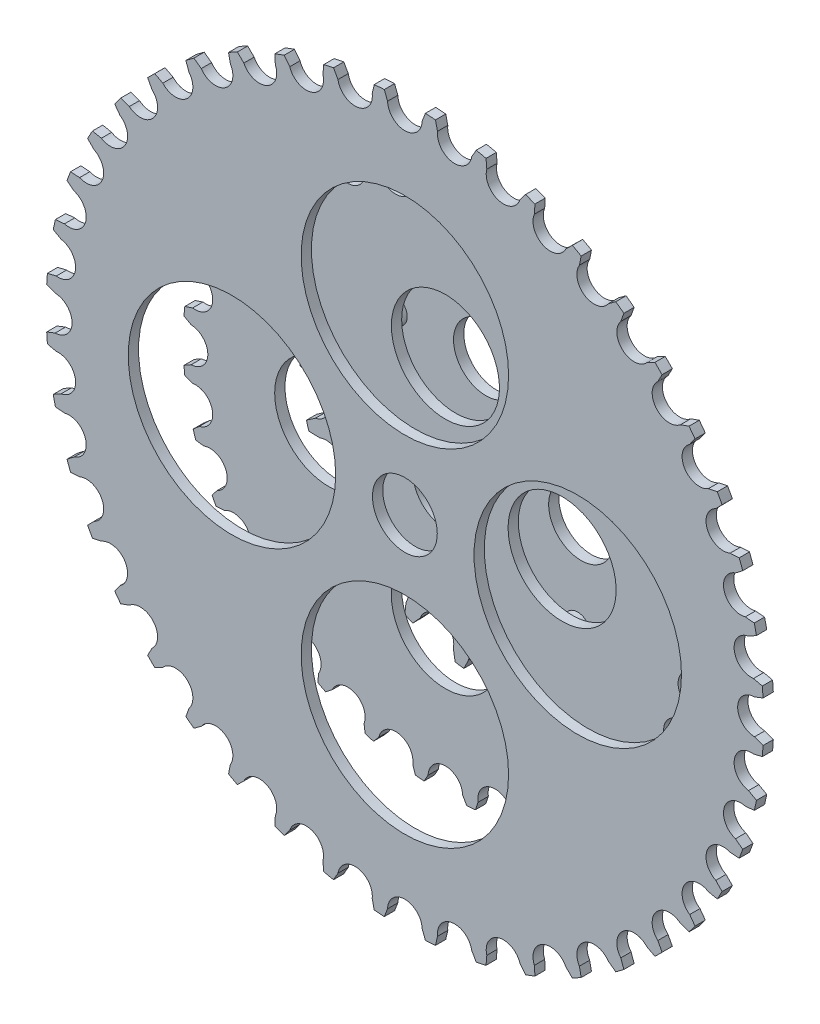
from build123d import *

# Parameters (mm, degrees)
IZIM1_R                     = 83
Y_KSEKLIK_EKSTR_ZYON1_DEPTH = 2.38
KES_EKSTR_ZYON1_REACH       = 119.404
DAIRESEL_O_ALTMA1_COUNT     = 44
KES_EKSTR_ZYON2_REACH       = 119.211
IZIM3_R                     = 24
IZIM3_R_2                   = 7.5
DAIRESEL_O_ALTMA2_COUNT     = 4
IZIM4_R                     = 2.5
Y_KSEKLIK_EKSTR_ZYON2_DEPTH = 7
DAIRESEL_O_ALTMA3_COUNT     = 4
IZIM5_R                     = 60.685
Y_KSEKLIK_EKSTR_ZYON3_DEPTH = 2.38
KES_EKSTR_ZYON3_REACH       = 119.775
DAIRESEL_O_ALTMA4_COUNT     = 32
KES_EKSTR_ZYON4_REACH       = 119.775
IZIM7_R                     = 12.5
IZIM8_R                     = 3
Y_KSEKLIK_EKSTR_ZYON4_DEPTH = 7
IZIM9_R                     = 43
Y_KSEKLIK_EKSTR_ZYON5_DEPTH = 2.38
KES_EKSTR_ZYON5_REACH       = 121.078
DAIRESEL_O_ALTMA5_COUNT     = 22
KES_EKSTR_ZYON6_REACH       = 121.078
IZIM13_R                    = 7.5
IZIM14_R                    = 7.5
KES_EKSTR_ZYON7_DEPTH       = 120.078107026


with BuildPart() as part:
    # Çizim1 → Yükseklik-Ekstrüzyon1 (new body)
    with BuildSketch(Plane.XY):
        Circle(IZIM1_R)
    extrude(amount=Y_KSEKLIK_EKSTR_ZYON1_DEPTH)

    # Çizim2 → Kes-Ekstrüzyon1 (cut, up to next)
    with BuildSketch(Plane.XY.offset(2.38), mode=Mode.PRIVATE) as kes_ekstr_zyon1_sk1:
        with BuildLine():
            Line((5.139003334, 83.842654089), (3.998780488, 80.901234568))
            ThreePointArc((3.998780488, 80.901234568), (0, 77), (-3.998780488, 80.901234568))
            Line((-3.998780488, 80.901234568), (-5.139003334, 83.842654089))
            ThreePointArc((-5.139003334, 83.842654089), (0, 84), (5.139003334, 83.842654089))
        make_face()
    kes_ekstr_zyon1_tool1 = extrude(kes_ekstr_zyon1_sk1.sketch, amount=-KES_EKSTR_ZYON1_REACH, mode=Mode.PRIVATE) & part.part
    kes_ekstr_zyon1 = kes_ekstr_zyon1_tool1.solids().sort_by_distance((0, 80.981356, 2.38))[0]
    add(kes_ekstr_zyon1, mode=Mode.SUBTRACT)

    # Dairesel Çoğaltma1: Kes-Ekstrüzyon1 ×44 about axis
    dairesel_o_altma1_axis = Axis((0, 0, 2.38), (0, 0, 1))
    for i in range(1, DAIRESEL_O_ALTMA1_COUNT):
        add(kes_ekstr_zyon1.rotate(dairesel_o_altma1_axis, i * 360 / DAIRESEL_O_ALTMA1_COUNT), mode=Mode.SUBTRACT)

    # Çizim3 → Kes-Ekstrüzyon2 (cut, up to next)
    with BuildSketch(Plane.XY.offset(2.38), mode=Mode.PRIVATE) as kes_ekstr_zyon2_sk1:
        with Locations((0, 40)):
            Circle(IZIM3_R)
    kes_ekstr_zyon2_tool1 = extrude(kes_ekstr_zyon2_sk1.sketch, amount=-KES_EKSTR_ZYON2_REACH, mode=Mode.PRIVATE) & part.part
    # Çizim3 → Kes-Ekstrüzyon2 (cut, up to next)
    with BuildSketch(Plane.XY.offset(2.38), mode=Mode.PRIVATE) as kes_ekstr_zyon2_sk2:
        Circle(IZIM3_R_2)
    kes_ekstr_zyon2_tool2 = extrude(kes_ekstr_zyon2_sk2.sketch, amount=-KES_EKSTR_ZYON2_REACH, mode=Mode.PRIVATE) & part.part
    kes_ekstr_zyon2_1 = kes_ekstr_zyon2_tool1.solids().sort_by_distance((0, 40, 2.38))[0]
    add(kes_ekstr_zyon2_1, mode=Mode.SUBTRACT)
    kes_ekstr_zyon2_2 = kes_ekstr_zyon2_tool2.solids().sort_by_distance((0, 0, 2.38))[0]
    add(kes_ekstr_zyon2_2, mode=Mode.SUBTRACT)
    kes_ekstr_zyon2 = kes_ekstr_zyon2_1 + kes_ekstr_zyon2_2  # Kes-Ekstrüzyon2 as one shape, for the pattern or mirror that repeats it

    # Dairesel Çoğaltma2: Kes-Ekstrüzyon2 ×4 about axis
    dairesel_o_altma2_axis = Axis((0, 0, 2.38), (0, 0, 1))
    for i in range(1, DAIRESEL_O_ALTMA2_COUNT):
        add(kes_ekstr_zyon2.rotate(dairesel_o_altma2_axis, i * 360 / DAIRESEL_O_ALTMA2_COUNT), mode=Mode.SUBTRACT)

    # Çizim4 → Yükseklik-Ekstrüzyon2 (add)
    with BuildSketch(Plane(origin=(0, 0, 0), x_dir=(-1, 0, 0), z_dir=(0, 0, -1))):
        with Locations((35.355339059, 35.355339059)):
            Circle(IZIM4_R)
    y_kseklik_ekstr_zyon2 = extrude(amount=Y_KSEKLIK_EKSTR_ZYON2_DEPTH)

    # Dairesel Çoğaltma3: Yükseklik-Ekstrüzyon2 ×4 about axis
    dairesel_o_altma3_axis = Axis((0, 0, 0), (0, 0, -1))
    for i in range(1, DAIRESEL_O_ALTMA3_COUNT):
        add(y_kseklik_ekstr_zyon2.rotate(dairesel_o_altma3_axis, i * 360 / DAIRESEL_O_ALTMA3_COUNT))

    # Çizim5 → Yükseklik-Ekstrüzyon3 (add)
    with BuildSketch(Plane(origin=(0, 0, -7), x_dir=(-1, 0, 0), z_dir=(0, 0, -1))):
        Circle(IZIM5_R)
    extrude(amount=Y_KSEKLIK_EKSTR_ZYON3_DEPTH)

    # Çizim6 → Kes-Ekstrüzyon3 (cut, up to next)
    with BuildSketch(Plane(origin=(0, 0, -9.38), x_dir=(-1, 0, 0), z_dir=(0, 0, -1)), mode=Mode.PRIVATE) as kes_ekstr_zyon3_sk1:
        with BuildLine():
            Line((3.997509486, 58.828147219), (4.948170161, 60.48293013))
            ThreePointArc((4.948170161, 60.48293013), (0, 60.685), (-4.948170161, 60.48293013))
            Line((-4.948170161, 60.48293013), (-3.997509486, 58.828147219))
            ThreePointArc((-3.997509486, 58.828147219), (0, 54.96927803), (3.997509486, 58.828147219))
        make_face()
    kes_ekstr_zyon3_tool1 = extrude(kes_ekstr_zyon3_sk1.sketch, amount=-KES_EKSTR_ZYON3_REACH, mode=Mode.PRIVATE) & part.part
    kes_ekstr_zyon3 = kes_ekstr_zyon3_tool1.solids().sort_by_distance((0, 58.225198, -9.38))[0]
    add(kes_ekstr_zyon3, mode=Mode.SUBTRACT)

    # Dairesel Çoğaltma4: Kes-Ekstrüzyon3 ×32 about axis
    dairesel_o_altma4_axis = Axis((0, 0, -9.38), (0, 0, -1))
    for i in range(1, DAIRESEL_O_ALTMA4_COUNT):
        add(kes_ekstr_zyon3.rotate(dairesel_o_altma4_axis, i * 360 / DAIRESEL_O_ALTMA4_COUNT), mode=Mode.SUBTRACT)

    # Çizim7 → Kes-Ekstrüzyon4 (cut, up to next)
    with BuildSketch(Plane(origin=(0, 0, -9.38), x_dir=(-1, 0, 0), z_dir=(0, 0, -1)), mode=Mode.PRIVATE) as kes_ekstr_zyon4_sk1:
        with Locations((0, 27)):
            Circle(IZIM7_R)
    kes_ekstr_zyon4_tool1 = extrude(kes_ekstr_zyon4_sk1.sketch, amount=-KES_EKSTR_ZYON4_REACH, mode=Mode.PRIVATE) & part.part
    # Çizim7 → Kes-Ekstrüzyon4 (cut, up to next)
    with BuildSketch(Plane(origin=(0, 0, -9.38), x_dir=(-1, 0, 0), z_dir=(0, 0, -1)), mode=Mode.PRIVATE) as kes_ekstr_zyon4_sk2:
        with Locations((27, 0)):
            Circle(IZIM7_R)
    kes_ekstr_zyon4_tool2 = extrude(kes_ekstr_zyon4_sk2.sketch, amount=-KES_EKSTR_ZYON4_REACH, mode=Mode.PRIVATE) & part.part
    # Çizim7 → Kes-Ekstrüzyon4 (cut, up to next)
    with BuildSketch(Plane(origin=(0, 0, -9.38), x_dir=(-1, 0, 0), z_dir=(0, 0, -1)), mode=Mode.PRIVATE) as kes_ekstr_zyon4_sk3:
        with Locations((0, -27)):
            Circle(IZIM7_R)
    kes_ekstr_zyon4_tool3 = extrude(kes_ekstr_zyon4_sk3.sketch, amount=-KES_EKSTR_ZYON4_REACH, mode=Mode.PRIVATE) & part.part
    # Çizim7 → Kes-Ekstrüzyon4 (cut, up to next)
    with BuildSketch(Plane(origin=(0, 0, -9.38), x_dir=(-1, 0, 0), z_dir=(0, 0, -1)), mode=Mode.PRIVATE) as kes_ekstr_zyon4_sk4:
        with Locations((-27, 0)):
            Circle(IZIM7_R)
    kes_ekstr_zyon4_tool4 = extrude(kes_ekstr_zyon4_sk4.sketch, amount=-KES_EKSTR_ZYON4_REACH, mode=Mode.PRIVATE) & part.part
    add(kes_ekstr_zyon4_tool1.solids().sort_by_distance((0, 27, -9.38))[0], mode=Mode.SUBTRACT)
    add(kes_ekstr_zyon4_tool2.solids().sort_by_distance((-27, 0, -9.38))[0], mode=Mode.SUBTRACT)
    add(kes_ekstr_zyon4_tool3.solids().sort_by_distance((0, -27, -9.38))[0], mode=Mode.SUBTRACT)
    add(kes_ekstr_zyon4_tool4.solids().sort_by_distance((27, 0, -9.38))[0], mode=Mode.SUBTRACT)

    # Çizim8 → Yükseklik-Ekstrüzyon4 (add)
    with BuildSketch(Plane(origin=(0, 0, -9.38), x_dir=(-1, 0, 0), z_dir=(0, 0, -1))):
        with Locations((21.213203436, 21.213203436)):
            Circle(IZIM8_R)
        with Locations((21.213203436, -21.213203436)):
            Circle(IZIM8_R)
        with Locations((-21.213203436, -21.213203436)):
            Circle(IZIM8_R)
        with Locations((-21.213203436, 21.213203436)):
            Circle(IZIM8_R)
    extrude(amount=Y_KSEKLIK_EKSTR_ZYON4_DEPTH)

    # Çizim9 → Yükseklik-Ekstrüzyon5 (add)
    with BuildSketch(Plane(origin=(0, 0, -16.38), x_dir=(-1, 0, 0), z_dir=(0, 0, -1))):
        Circle(IZIM9_R)
    extrude(amount=Y_KSEKLIK_EKSTR_ZYON5_DEPTH)

    # Çizim12 → Kes-Ekstrüzyon5 (cut, up to next)
    with BuildSketch(Plane(origin=(0, 0, -18.76), x_dir=(-1, 0, 0), z_dir=(0, 0, -1)), mode=Mode.PRIVATE) as kes_ekstr_zyon5_sk1:
        with BuildLine():
            Line((3.995147135, 40.417201225), (5.119538046, 42.694148665))
            ThreePointArc((5.119538046, 42.694148665), (0, 43), (-5.119538046, 42.694148665))
            Line((-5.119538046, 42.694148665), (-3.995147135, 40.417201225))
            ThreePointArc((-3.995147135, 40.417201225), (0, 36.61417678), (3.995147135, 40.417201225))
        make_face()
    kes_ekstr_zyon5_tool1 = extrude(kes_ekstr_zyon5_sk1.sketch, amount=-KES_EKSTR_ZYON5_REACH, mode=Mode.PRIVATE) & part.part
    kes_ekstr_zyon5 = kes_ekstr_zyon5_tool1.solids().sort_by_distance((0, 40.239198, -18.76))[0]
    add(kes_ekstr_zyon5, mode=Mode.SUBTRACT)

    # Dairesel Çoğaltma5: Kes-Ekstrüzyon5 ×22 about axis
    dairesel_o_altma5_axis = Axis((0, 0, -18.76), (0, 0, -1))
    for i in range(1, DAIRESEL_O_ALTMA5_COUNT):
        add(kes_ekstr_zyon5.rotate(dairesel_o_altma5_axis, i * 360 / DAIRESEL_O_ALTMA5_COUNT), mode=Mode.SUBTRACT)

    # Çizim13 → Kes-Ekstrüzyon6 (cut, up to next)
    with BuildSketch(Plane(origin=(0, 0, -18.76), x_dir=(-1, 0, 0), z_dir=(0, 0, -1)), mode=Mode.PRIVATE) as kes_ekstr_zyon6_sk1:
        with Locations((0, 22)):
            Circle(IZIM13_R)
    kes_ekstr_zyon6_tool1 = extrude(kes_ekstr_zyon6_sk1.sketch, amount=-KES_EKSTR_ZYON6_REACH, mode=Mode.PRIVATE) & part.part
    # Çizim13 → Kes-Ekstrüzyon6 (cut, up to next)
    with BuildSketch(Plane(origin=(0, 0, -18.76), x_dir=(-1, 0, 0), z_dir=(0, 0, -1)), mode=Mode.PRIVATE) as kes_ekstr_zyon6_sk2:
        with Locations((22, 0)):
            Circle(IZIM13_R)
    kes_ekstr_zyon6_tool2 = extrude(kes_ekstr_zyon6_sk2.sketch, amount=-KES_EKSTR_ZYON6_REACH, mode=Mode.PRIVATE) & part.part
    # Çizim13 → Kes-Ekstrüzyon6 (cut, up to next)
    with BuildSketch(Plane(origin=(0, 0, -18.76), x_dir=(-1, 0, 0), z_dir=(0, 0, -1)), mode=Mode.PRIVATE) as kes_ekstr_zyon6_sk3:
        with Locations((0, -22)):
            Circle(IZIM13_R)
    kes_ekstr_zyon6_tool3 = extrude(kes_ekstr_zyon6_sk3.sketch, amount=-KES_EKSTR_ZYON6_REACH, mode=Mode.PRIVATE) & part.part
    # Çizim13 → Kes-Ekstrüzyon6 (cut, up to next)
    with BuildSketch(Plane(origin=(0, 0, -18.76), x_dir=(-1, 0, 0), z_dir=(0, 0, -1)), mode=Mode.PRIVATE) as kes_ekstr_zyon6_sk4:
        with Locations((-22, 0)):
            Circle(IZIM13_R)
    kes_ekstr_zyon6_tool4 = extrude(kes_ekstr_zyon6_sk4.sketch, amount=-KES_EKSTR_ZYON6_REACH, mode=Mode.PRIVATE) & part.part
    add(kes_ekstr_zyon6_tool1.solids().sort_by_distance((0, 22, -18.76))[0], mode=Mode.SUBTRACT)
    add(kes_ekstr_zyon6_tool2.solids().sort_by_distance((-22, 0, -18.76))[0], mode=Mode.SUBTRACT)
    add(kes_ekstr_zyon6_tool3.solids().sort_by_distance((0, -22, -18.76))[0], mode=Mode.SUBTRACT)
    add(kes_ekstr_zyon6_tool4.solids().sort_by_distance((22, 0, -18.76))[0], mode=Mode.SUBTRACT)

    # Çizim14 → Kes-Ekstrüzyon7 (cut, through all)
    with BuildSketch(Plane.XY.offset(2.38)):
        Circle(IZIM14_R)
    extrude(amount=-KES_EKSTR_ZYON7_DEPTH, mode=Mode.SUBTRACT)


solid = part.part
